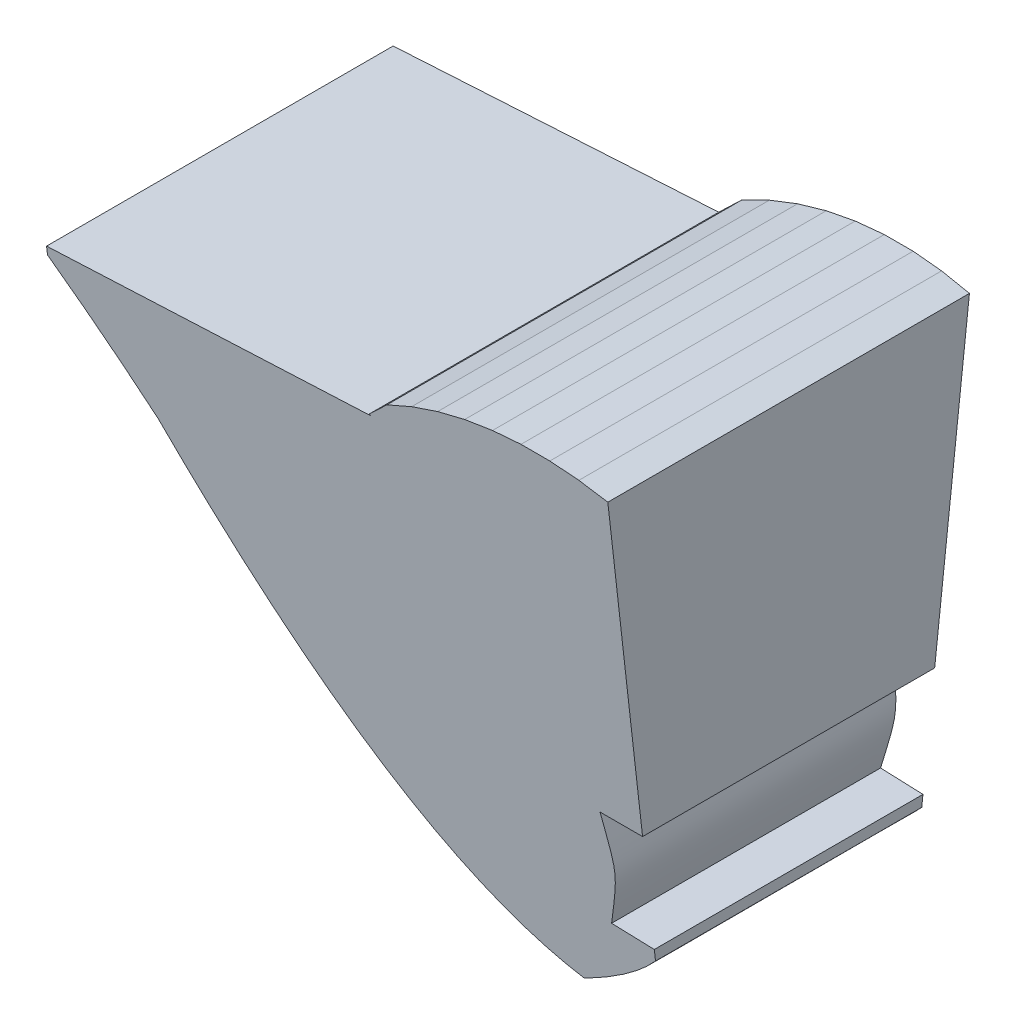
from build123d import *

# Parameters (mm, degrees)
SALIENTE_EXTRUIR1_DEPTH      = 7.21
SALIENTE_EXTRUIR2_DEPTH      = 7.21
SALIENTE_EXTRUIR2_DEPTH_BACK = 7.21
CORTAR_EXTRUIR2_DEPTH        = 28.232395202
CORTAR_EXTRUIR2_DEPTH_BACK   = 28.232395202
SALIENTE_EXTRUIR3_START      = -5.2099999
SALIENTE_EXTRUIR3_DEPTH      = 10.4199998
SALIENTE_EXTRUIR3_START_2    = -7.470713012
SALIENTE_EXTRUIR3_2_DEPTH    = 14.941425924
SALIENTE_EXTRUIR3_START_3    = -23.035921246
SALIENTE_EXTRUIR3_3_DEPTH    = 24.035921246


with BuildPart() as part:
    # Croquis1 → Saliente-Extruir1 (new, symmetric)
    with BuildSketch(Plane.XY):
        with BuildLine():
            add(Edge.make_bspline(
                [(-18.945192114, 7.540918896), (-10.215008384, -3.697644103), (-2.846604825, -5.059081104)],
                knots=[0.497667241, 0.497667241, 0.497667241, 0.49955428, 0.49955428, 0.49955428], degree=2, weights=[1, 1, 1]))
            add(Edge.make_bspline(
                [(-2.846604825, -5.059081104), (-0.742366882, -3.9352066), (0.355125, -2.723253227)],
                knots=[0.498812075, 0.498812075, 0.498812075, 0.499412845, 0.499412845, 0.499412845], degree=2, weights=[1, 1, 1]))
            Line((0.355125, -2.723253227), (0.355125, -2.284841781))
            Line((0.355125, -2.284841781), (-1.394875, -2.223730435))
            add(Edge.make_bspline(
                [(-1.394875, -2.223730435), (-0.90753067, -0.123730435), (-1.394875, 1.976269565)],
                knots=[0, 0, 0, 1, 1, 1], degree=2, weights=[1, 3.231801219, 1]))
            Line((-1.394875, 1.976269565), (0.355125, 2.284841781))
            Line((0.355125, 2.284841781), (0.355125, 3.001549529))
            add(Edge.make_bspline(
                [(0.355125, 3.001549529), (-1.44872627, 6.058427314), (-6.994875026, 10.477389992)],
                knots=[0.500820705, 0.500820705, 0.500820705, 0.502013312, 0.502013312, 0.502013312], degree=2, weights=[1, 1, 1]))
            Line((-6.994875026, 10.477389992), (-8.981845695, 12.608155172))
            Line((-8.981845695, 12.608155172), (-23.035921146, 11.871612288))
            Line((-23.035921146, 11.871612288), (-23.035921146, 11.54013782))
            ThreePointArc((-23.035921146, 11.54013782), (-20.949684518, 9.582335705), (-18.945192114, 7.540918896))
        make_face()
    extrude(amount=SALIENTE_EXTRUIR1_DEPTH, both=True)

    # Croquis4 → Saliente-Extruir2 (add, two sides: drawn at the far end of the back side and taken through both)
    with BuildSketch(Plane.XY.offset(-SALIENTE_EXTRUIR2_DEPTH_BACK)):
        Polygon((-1.394875, 1.976269565), (0.355125, 2.284841781), (0.355125, 1.976269565), align=None)
    extrude(amount=SALIENTE_EXTRUIR2_DEPTH + SALIENTE_EXTRUIR2_DEPTH_BACK)

    # Croquis6 → Cortar-Extruir2 (cut, two sides: drawn at the far end of the back side and taken through both)
    with BuildSketch(Plane(origin=(0, 0, 0), x_dir=(0, 0, -1), z_dir=(1, 0, 0)).offset(-CORTAR_EXTRUIR2_DEPTH_BACK)):
        Polygon((7.21, 12.608155172), (7.21, -5.059081104), (5.21, -5.059081104), align=None)
        Polygon((-7.21, 12.608155172), (-7.21, -5.059081104), (-5.21, -5.059081104), align=None)
    extrude(amount=CORTAR_EXTRUIR2_DEPTH + CORTAR_EXTRUIR2_DEPTH_BACK, mode=Mode.SUBTRACT)

    # Saliente-Extruir3: read off the stored shape, not the designer's step
    # Saliente-Extruir3 outline → Saliente-Extruir3 (add)
    with BuildSketch(Plane.XY.offset(SALIENTE_EXTRUIR3_START)):
        with BuildLine():
            add(Edge.make_bspline(
                [(-9.626736117, 12.574357897), (-9.652391468, 12.594799115), (-9.678046818, 12.615240333)],
                knots=[0.502296281, 0.502296281, 0.502296281, 0.502301797, 0.502301797, 0.502301797], degree=2))
            Line((-9.626736117, 12.574357897), (-8.981845695, 12.608155172))
            Line((-8.981845695, 12.608155172), (-6.994875026, 10.477389992))
            add(Edge.make_bspline(
                [(0.355125, 3.001549529), (-1.44872627, 6.058427314), (-6.994875026, 10.477389992)],
                knots=[0.500820705, 0.500820705, 0.500820705, 0.502013312, 0.502013312, 0.502013312], degree=2))
            Line((0.355125, 3.001549529), (0.355125, 14.601784752))
            Line((0.355125, 14.601784752), (-0.813216768, 14.807794929))
            Line((-0.813216768, 14.807794929), (-1.995067613, 14.91119348))
            Line((-1.995067613, 14.91119348), (-3.181432936, 14.91119348))
            Line((-3.181432936, 14.91119348), (-4.363283782, 14.807794929))
            Line((-4.363283782, 14.807794929), (-5.53162555, 14.601784752))
            Line((-5.53162555, 14.601784752), (-6.677566455, 14.294730812))
            Line((-6.677566455, 14.294730812), (-7.792385195, 13.888969974))
            Line((-7.792385195, 13.888969974), (-8.867597325, 13.387590324))
            Line((-8.867597325, 13.387590324), (-9.678046818, 12.615240333))
        make_face()
    extrude(amount=SALIENTE_EXTRUIR3_DEPTH)

    # Saliente-Extruir3 2 outline → Saliente-Extruir3 2 (add)
    with BuildSketch(Plane.XY.offset(SALIENTE_EXTRUIR3_START_2)):
        with BuildLine():
            add(Edge.make_bspline(
                [(-9.626736117, 12.574357897), (-9.652391468, 12.594799115), (-9.678046818, 12.615240333)],
                knots=[0.502296281, 0.502296281, 0.502296281, 0.502301797, 0.502301797, 0.502301797], degree=2))
            Line((-9.626736117, 12.574357897), (-8.981845695, 12.608155172))
            Line((-8.981845695, 12.608155172), (-6.994875026, 10.477389992))
            add(Edge.make_bspline(
                [(0.355125, 3.001549529), (-1.44872627, 6.058427314), (-6.994875026, 10.477389992)],
                knots=[0.500820705, 0.500820705, 0.500820705, 0.502013312, 0.502013312, 0.502013312], degree=2))
            Line((0.355125, 3.001549529), (0.355125, 14.601784752))
            Line((0.355125, 14.601784752), (-0.813216768, 14.807794929))
            Line((-0.813216768, 14.807794929), (-1.995067613, 14.91119348))
            Line((-1.995067613, 14.91119348), (-3.181432936, 14.91119348))
            Line((-3.181432936, 14.91119348), (-4.363283782, 14.807794929))
            Line((-4.363283782, 14.807794929), (-5.53162555, 14.601784752))
            Line((-5.53162555, 14.601784752), (-6.677566455, 14.294730812))
            Line((-6.677566455, 14.294730812), (-7.792385195, 13.888969974))
            Line((-7.792385195, 13.888969974), (-8.867597325, 13.387590324))
            Line((-8.867597325, 13.387590324), (-9.678046818, 12.615240333))
        make_face()
    extrude(amount=SALIENTE_EXTRUIR3_2_DEPTH)

    # Saliente-Extruir3 3 outline → Saliente-Extruir3 3 (cut)
    with BuildSketch(Plane.YZ.offset(SALIENTE_EXTRUIR3_START_3)):
        Polygon((2, 7.470712912), (2, 6.009115492), (14.91119348, 7.470712912), align=None)
        Polygon((14.91119348, -7.470712912), (2, -6.009115492), (2, -7.470713012), align=None)
    extrude(amount=SALIENTE_EXTRUIR3_3_DEPTH, mode=Mode.SUBTRACT)


solid = part.part
